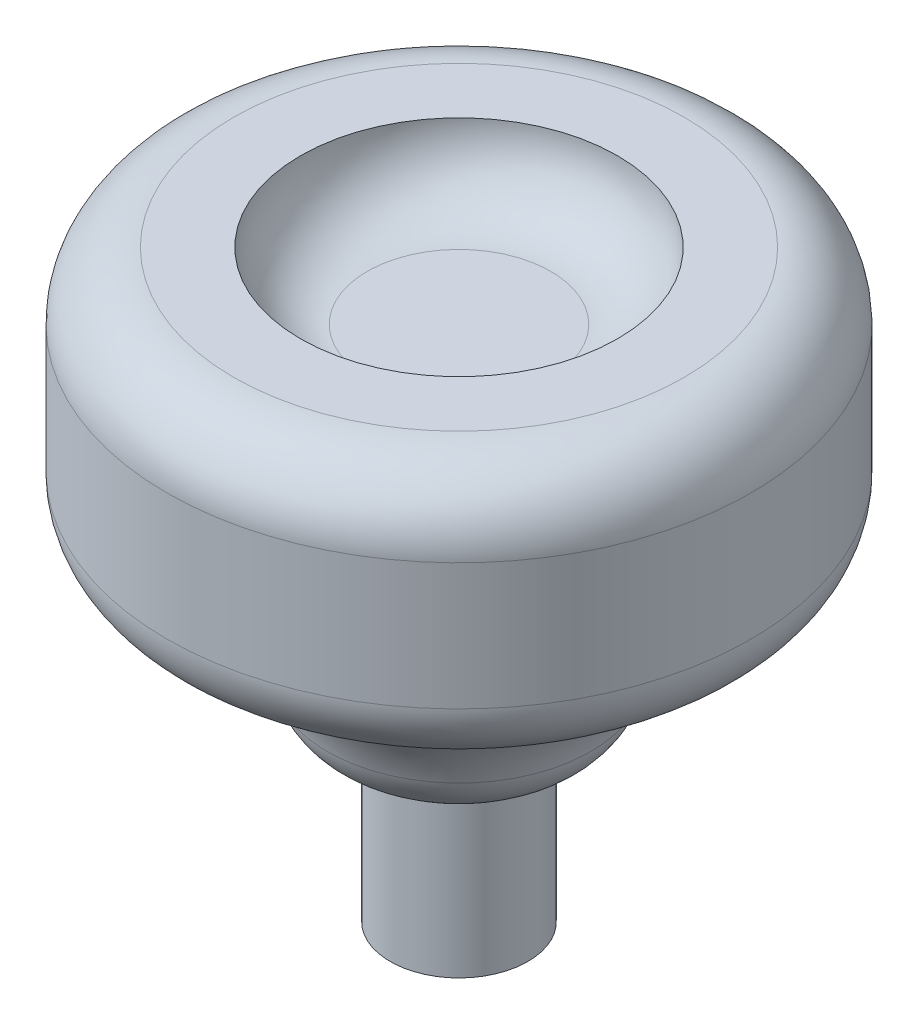
from build123d import *

# Parameters (mm, degrees)
FILLET1_R          = 2.54
SKETCH2_R          = 6.0325
CUT_EXTRUDE1_DEPTH = 2.54
FILLET2_R          = 2.54
SKETCH4_OUTSIDE_W  = 31.924
SKETCH4_OUTSIDE_H  = 31.924
SKETCH4_OUTSIDE_R  = 2.62
CUT_EXTRUDE2_DEPTH = 6.35


# Some blends are built 0.0001 mm under size
with BuildPart() as part:
    # Sketch1 → Base-Revolve (revolve)
    with BuildSketch(Plane.XY, mode=Mode.PRIVATE) as base_revolve_sk:
        with BuildLine():
            ThreePointArc((11.1125, 12.7), (6.622371939, 10.840128061), (4.7625, 6.35))
            Line((4.7625, 6.35), (3.175, 6.35))
            Line((3.175, 6.35), (3.175, 0))
            Line((3.175, 0), (0, 0))
            Line((0, 0), (0, 22.225))
            Line((0, 22.225), (11.1125, 22.225))
            Line((11.1125, 22.225), (11.1125, 12.7))
        make_face()
    revolve(base_revolve_sk.sketch.rotate(Axis((0, 0, 0), (0, 1, 0)), 90), axis=Axis((0, 0, 0), (0, 1, 0)))

    # Fillet1
    # the kernel refuses this fillet: 2.54 mm, written as the material it takes off along each edge
    with BuildSketch(Plane(origin=(0, 6.35, 0), x_dir=(0, 0, -1), z_dir=(1, 0, 0))) as fillet1_piece_1:
        with BuildLine():
            CenterArc((2.57175, 2.467324348), FILLET1_R, 283.739035174, 60.14756783)
            Line((3.175, 0), (3.187065, -0.049346487))
            ThreePointArc((3.187065, -0.049346487), (3.96875, -0.0508), (4.7625, -0.0508))
            Line((4.7625, -0.0508), (4.8133, 0))
            ThreePointArc((4.8133, 0), (4.875473976, 0.882851637), (5.060768571, 1.748275538))
            Line((5.060768571, 1.748275538), (5.011964286, 1.762374534))
        make_face()
    revolve(axis=Axis((0, 6.35, 0), (0, 1, 0)), mode=Mode.SUBTRACT)
    with BuildSketch(Plane(origin=(0, 22.225, 0), x_dir=(0, 0, -1), z_dir=(1, 0, 0))) as fillet1_piece_2:
        with BuildLine():
            CenterArc((11.1125 - FILLET1_R, -FILLET1_R), FILLET1_R, 0, 90)
            Line((11.1125, -FILLET1_R), (11.1125 + FILLET1_R * 0.02, -FILLET1_R))
            Line((11.1125 + FILLET1_R * 0.02, -FILLET1_R), (11.1125 + FILLET1_R * 0.02, FILLET1_R * 0.02))
            Line((11.1125 + FILLET1_R * 0.02, FILLET1_R * 0.02), (11.1125 - FILLET1_R, FILLET1_R * 0.02))
            Line((11.1125 - FILLET1_R, FILLET1_R * 0.02), (11.1125 - FILLET1_R, 0))
        make_face()
    revolve(axis=Axis((0, 22.225, 0), (0, 1, 0)), mode=Mode.SUBTRACT)
    with BuildSketch(Plane(origin=(0, 12.7, 0), x_dir=(0, 0, -1), z_dir=(1, 0, 0))) as fillet1_piece_3:
        with BuildLine():
            CenterArc((8.5725, 2.169418994), FILLET1_R, 286.601549599, 73.398450401)
            Line((11.1125, 2.169418994), (11.1633, 2.169418994))
            Line((11.1633, 2.169418994), (11.1633, 0))
            Line((11.1633, 0), (11.1125, -0.0508))
            ThreePointArc((11.1125, -0.0508), (10.203087128, -0.116791447), (9.312728571, -0.313383113))
            Line((9.312728571, -0.313383113), (9.298214286, -0.264700718))
        make_face()
    revolve(axis=Axis((0, 12.7, 0), (0, 1, 0)), mode=Mode.SUBTRACT)

    # Sketch2 → Cut-Extrude1 (cut)
    with BuildSketch(Plane(origin=(0, 22.225, 0), x_dir=(1, 0, 0), z_dir=(0, 1, 0))):
        with Locations(Location((0, 0, 0), (0, 0, 270))):
            Circle(SKETCH2_R)
    extrude(amount=-CUT_EXTRUDE1_DEPTH, mode=Mode.SUBTRACT)

    # Fillet2
    fillet2_edges = [part.edges().sort_by_distance(p)[0] for p in [
        (0, 19.685, -6.0325),
    ]]
    fillet(fillet2_edges, radius=FILLET2_R - 0.0001)  # a hair under: the kernel refuses the full size

    # Sketch4 outside → Cut-Extrude2 (cut)
    with BuildSketch(Plane.XZ):
        Rectangle(SKETCH4_OUTSIDE_W, SKETCH4_OUTSIDE_H)
        with Locations(Location((0, 0, 0), (0, 0, 270))):
            Circle(SKETCH4_OUTSIDE_R, mode=Mode.SUBTRACT)
    extrude(amount=-CUT_EXTRUDE2_DEPTH, mode=Mode.SUBTRACT)


solid = part.part
